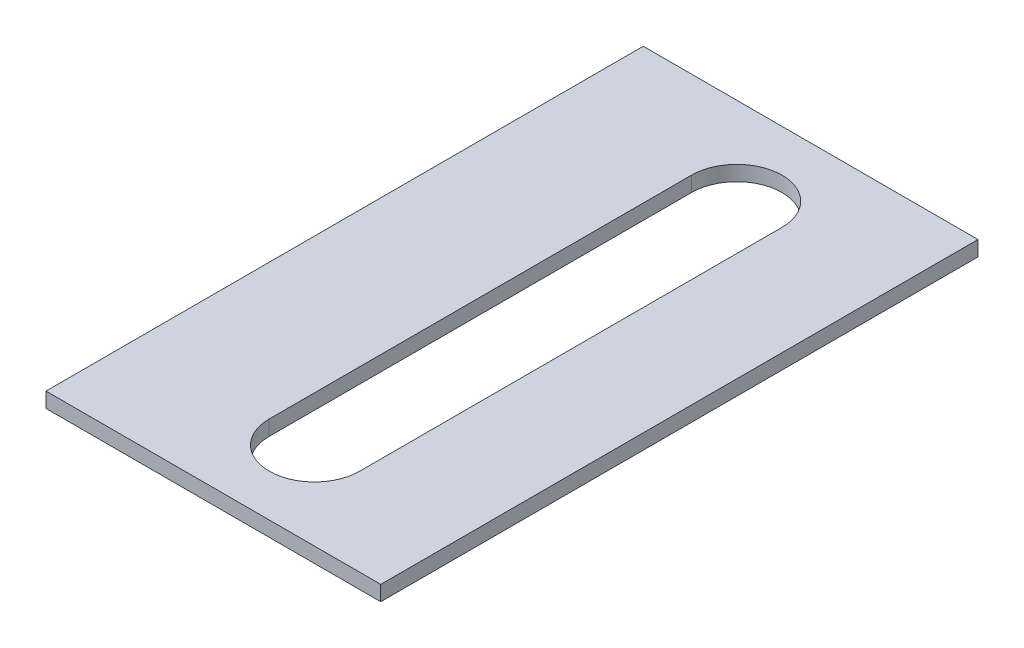
from build123d import *

# Parameters (mm, degrees)
SKETCH1_W               = 13.8
SKETCH1_H               = 8.8
BOSS_EXTRUDE1_DEPTH     = 3
SKETCH2_W               = 2
SKETCH2_H               = 35
BOSS_EXTRUDE2_DEPTH     = 3
SKETCH3_W               = 1.2
SKETCH3_H               = 6
BOSS_EXTRUDE3_DEPTH     = 7
FILLET3_R               = 10
SKETCH5_W               = 15
SKETCH5_H               = 13.8
BOSS_EXTRUDE4_DEPTH     = 4
SKETCH6_R               = 1.5
CUT_EXTRUDE4_DEPTH      = 38.968539608
BOSS_EXTRUDE5_DEPTH     = 2
CHAMFER2_SIZE           = 3
BOSS_EXTRUDE7_DEPTH     = 1.2
SKETCH12_W              = 15
SKETCH12_H              = 4
BOSS_EXTRUDE8_DEPTH     = 3
SKETCH13_W              = 15
SKETCH13_H              = 4
BOSS_EXTRUDE9_DEPTH     = 3
CUT_EXTRUDE7_DEPTH      = 43.28486727
CUT_EXTRUDE7_DEPTH_BACK = 43.28486727
CUT_EXTRUDE8_DEPTH      = 43.28486727
CUT_EXTRUDE8_DEPTH_BACK = 43.28486727
SKETCH15_W              = 0.807911756
SKETCH15_H              = 0.64
CUT_EXTRUDE9_DEPTH      = 41.244591358
CUT_EXTRUDE9_DEPTH_BACK = 41.244591358
SKETCH16_W              = 0.64
SKETCH16_H              = 0.6
CHAMFER3_SIZE           = 1
SKETCH18_W              = 20.701942652
SKETCH18_H              = 41.728044518
CUT_EXTRUDE10_DEPTH     = 36
SKETCH19_W              = 11.097134513
SKETCH19_H              = 20.928514419
CUT_EXTRUDE11_DEPTH     = 3.5


# Some blends are built 0.0001 mm under size
with BuildPart() as part:
    # Sketch1 → Boss-Extrude1 (new body)
    with BuildSketch(Plane(origin=(0, 0, 0), x_dir=(0, 0, -1), z_dir=(1, 0, 0))):
        Rectangle(SKETCH1_W, SKETCH1_H)
    extrude(amount=BOSS_EXTRUDE1_DEPTH)

    # Sketch2 → Boss-Extrude2 (add)
    with BuildSketch(Plane(origin=(3, 0, 0), x_dir=(0, 0, -1), z_dir=(1, 0, 0))):
        with Locations((0, -13.1)):
            Rectangle(SKETCH2_W, SKETCH2_H)
    extrude(amount=BOSS_EXTRUDE2_DEPTH)

    # Sketch3 → Boss-Extrude3 (add)
    with BuildSketch(Plane(origin=(6, 0, 0), x_dir=(0, 0, -1), z_dir=(1, 0, 0))):
        with Locations((0, -27.6)):
            Rectangle(SKETCH3_W, SKETCH3_H)
    extrude(amount=BOSS_EXTRUDE3_DEPTH)

    # Fillet3
    # the kernel refuses this fillet: 10 mm, written as the material it adds along each edge
    with BuildSketch(Plane(origin=(3, -4.4, 1), x_dir=(-1, 0, 0), z_dir=(0, 0, -1))) as fillet3_piece_1:
        with BuildLine():
            CenterArc((10, -7.141428429), FILLET3_R, 134.427004001, 45.572995999)
            Line((0, -7.141428429), (0, 0))
            Line((0, 0), (3, 0))
        make_face()
    extrude(amount=2)

    # Sketch5 → Boss-Extrude4 (add)
    with BuildSketch(Plane(origin=(0, 4.4, 0), x_dir=(1, 0, 0), z_dir=(0, 1, 0))):
        with Locations((-4.5, 0)):
            Rectangle(SKETCH5_W, SKETCH5_H)
    extrude(amount=BOSS_EXTRUDE4_DEPTH)

    # Sketch6 → Cut-Extrude4 (cut, through all)
    with BuildSketch(Plane.XZ.offset(-4.4)):
        with Locations(Location((-6, 3, 0), (0, 0, 270))):
            Circle(SKETCH6_R)
        with Locations(Location((-6, -3, 0), (0, 0, 270))):
            Circle(SKETCH6_R)
    extrude(amount=-CUT_EXTRUDE4_DEPTH, mode=Mode.SUBTRACT)

    # Sketch8 → Boss-Extrude5 (add)
    with BuildSketch(Plane(origin=(0, 0, -1), x_dir=(-1, 0, 0), z_dir=(0, 0, -1))):
        Polygon((-3, -18.758153574), (0, -4.4), (-3, -4.4), align=None)
    extrude(amount=-BOSS_EXTRUDE5_DEPTH)

    # Chamfer2
    chamfer2_edges = [part.edges().sort_by_distance(p)[0] for p in [
        (3, 4.4, 0),
    ]]
    chamfer(chamfer2_edges, length=CHAMFER2_SIZE - 0.0001)  # a hair under: the kernel refuses the full size

    # Sketch11 → Boss-Extrude7 (add)
    with BuildSketch(Plane(origin=(0, 0, -0.6), x_dir=(-1, 0, 0), z_dir=(0, 0, -1))):
        Polygon((-6, -24.6), (-13, -24.6), (-6, 1.742521041), align=None)
    extrude(amount=-BOSS_EXTRUDE7_DEPTH)

    # Sketch12 → Boss-Extrude8 (add)
    with BuildSketch(Plane(origin=(0, 0, -6.9), x_dir=(-1, 0, 0), z_dir=(0, 0, -1))):
        with Locations((4.5, 6.4)):
            Rectangle(SKETCH12_W, SKETCH12_H)
    extrude(amount=BOSS_EXTRUDE8_DEPTH)

    # Sketch13 → Boss-Extrude9 (add)
    with BuildSketch(Plane.XY.offset(6.9)):
        with Locations((-4.5, 6.4)):
            Rectangle(SKETCH13_W, SKETCH13_H)
    extrude(amount=BOSS_EXTRUDE9_DEPTH)

    # Sketch14 → Cut-Extrude7 (cut, two sides: drawn at the far end of the back side and taken through both)
    with BuildSketch(Plane(origin=(0, 8.4, 0), x_dir=(1, 0, 0), z_dir=(0, 1, 0)).offset(-CUT_EXTRUDE7_DEPTH_BACK)):
        with BuildLine():
            Line((-7.5, 7), (-7.5, -7))
            ThreePointArc((-7.5, -7), (-6, -8.5), (-4.5, -7))
            Line((-4.5, -7), (-4.5, 7))
            ThreePointArc((-4.5, 7), (-6, 8.5), (-7.5, 7))
        make_face()
    extrude(amount=CUT_EXTRUDE7_DEPTH + CUT_EXTRUDE7_DEPTH_BACK, mode=Mode.SUBTRACT)

    # Sketch15 → Cut-Extrude8 (cut, two sides: drawn at the far end of the back side and taken through both)
    with BuildSketch(Plane.XZ.offset(30.6).offset(-CUT_EXTRUDE8_DEPTH_BACK)):
        with Locations((12.596044122, 0)):
            Rectangle(SKETCH15_W, SKETCH15_H)
    extrude(amount=CUT_EXTRUDE8_DEPTH + CUT_EXTRUDE8_DEPTH_BACK, mode=Mode.SUBTRACT)

    # Sketch16 → Cut-Extrude9 (cut, two sides: drawn at the far end of the back side and taken through both)
    with BuildSketch(Plane(origin=(12.192088244, 0, 0), x_dir=(0, 0, -1), z_dir=(1, 0, 0)).offset(-CUT_EXTRUDE9_DEPTH_BACK)):
        with Locations((0, -30.3)):
            Rectangle(SKETCH16_W, SKETCH16_H)
    extrude(amount=CUT_EXTRUDE9_DEPTH + CUT_EXTRUDE9_DEPTH_BACK, mode=Mode.SUBTRACT)

    # Chamfer3
    chamfer3_edges = [part.edges().sort_by_distance(p)[0] for p in [
        (12.192088244, -30, 0),
    ]]
    chamfer(chamfer3_edges, length=CHAMFER3_SIZE)

    # Sketch18 → Cut-Extrude10 (cut)
    with BuildSketch(Plane.XY.offset(9.9)):
        with Locations((9.448105839, -12.464022259)):
            Rectangle(SKETCH18_W, SKETCH18_H)
    extrude(amount=-CUT_EXTRUDE10_DEPTH, mode=Mode.SUBTRACT)

    # Sketch19 → Cut-Extrude11 (cut)
    with BuildSketch(Plane.XZ.offset(-4.4)):
        with Locations((-6.451432743, 0.56425721)):
            Rectangle(SKETCH19_W, SKETCH19_H)
    extrude(amount=-CUT_EXTRUDE11_DEPTH, mode=Mode.SUBTRACT)


solid = part.part
